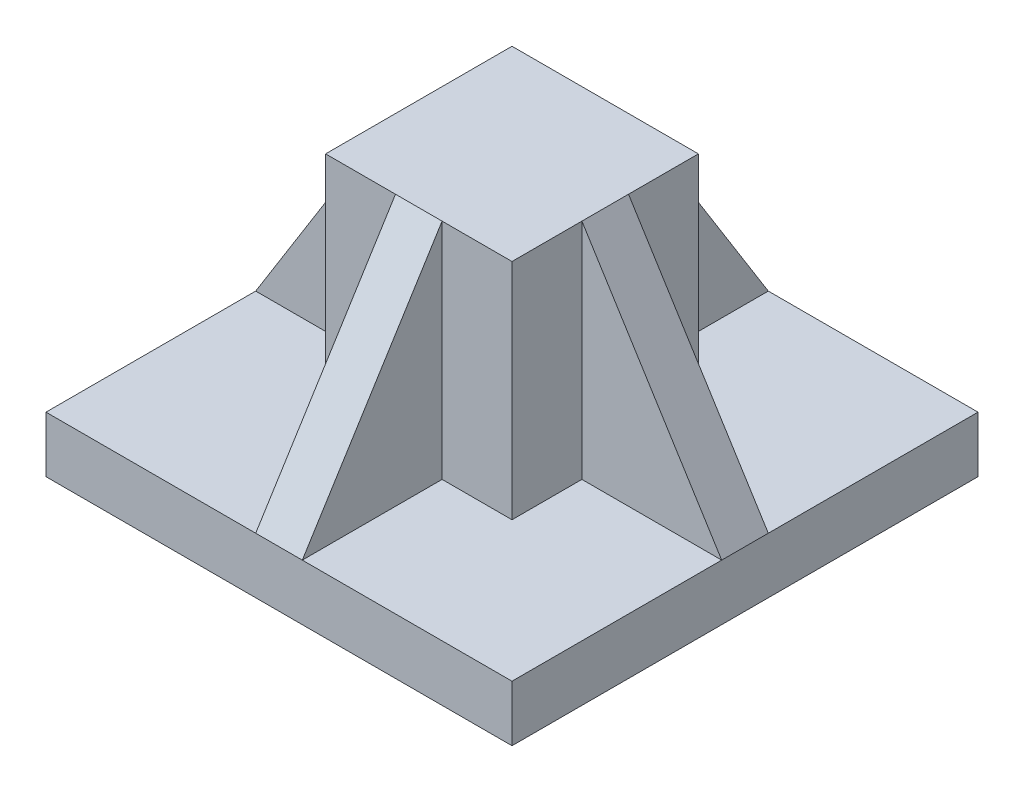
from build123d import *

# Parameters (mm, degrees)
SKETCH1_W           = 40
SKETCH1_H           = 40
BOSS_EXTRUDE1_DEPTH = 60
SKETCH1_3_W         = 100
SKETCH1_3_H         = 100
SKETCH1_3_W_2       = 40
SKETCH1_3_H_2       = 40
BOSS_EXTRUDE2_DEPTH = 12
RIB1_REACH          = 94.736
SKETCH2_WALL_W      = 244.076256702
SKETCH2_WALL_H      = 10
CIRPATTERN1_COUNT   = 4


with BuildPart() as part:
    # Sketch1 → Boss-Extrude1 (new body)
    with BuildSketch(Plane(origin=(0, 0, 0), x_dir=(1, 0, 0), z_dir=(0, 1, 0))):
        Rectangle(SKETCH1_W, SKETCH1_H)
    extrude(amount=BOSS_EXTRUDE1_DEPTH)

    # Sketch1<3> → Boss-Extrude2 (add)
    with BuildSketch(Plane(origin=(0, 0, 0), x_dir=(1, 0, 0), z_dir=(0, 1, 0))):
        Rectangle(SKETCH1_3_W, SKETCH1_3_H)
        Rectangle(SKETCH1_3_W_2, SKETCH1_3_H_2, mode=Mode.SUBTRACT)
    extrude(amount=BOSS_EXTRUDE2_DEPTH)

    # Sketch2 wall → Rib1 (add, up to next)
    with BuildSketch(Plane(origin=(35, 36, 0), x_dir=(0.529998940003, -0.847998304005, 0), z_dir=(0.847998304005, 0.529998940003, 0)), mode=Mode.PRIVATE) as rib1_sk1:
        Rectangle(SKETCH2_WALL_W, SKETCH2_WALL_H)
    rib1_tool1 = extrude(rib1_sk1.sketch, amount=-RIB1_REACH, mode=Mode.PRIVATE) - part.part
    rib1 = rib1_tool1.solids().sort_by_distance((35, 36, 0))[0]
    add(rib1)

    # CirPattern1: Rib1 ×4 about axis
    cirpattern1_axis = Axis((0, 60, 0), (0, 1, 0))
    for i in range(1, CIRPATTERN1_COUNT):
        add(rib1.rotate(cirpattern1_axis, i * 360 / CIRPATTERN1_COUNT))


solid = part.part
